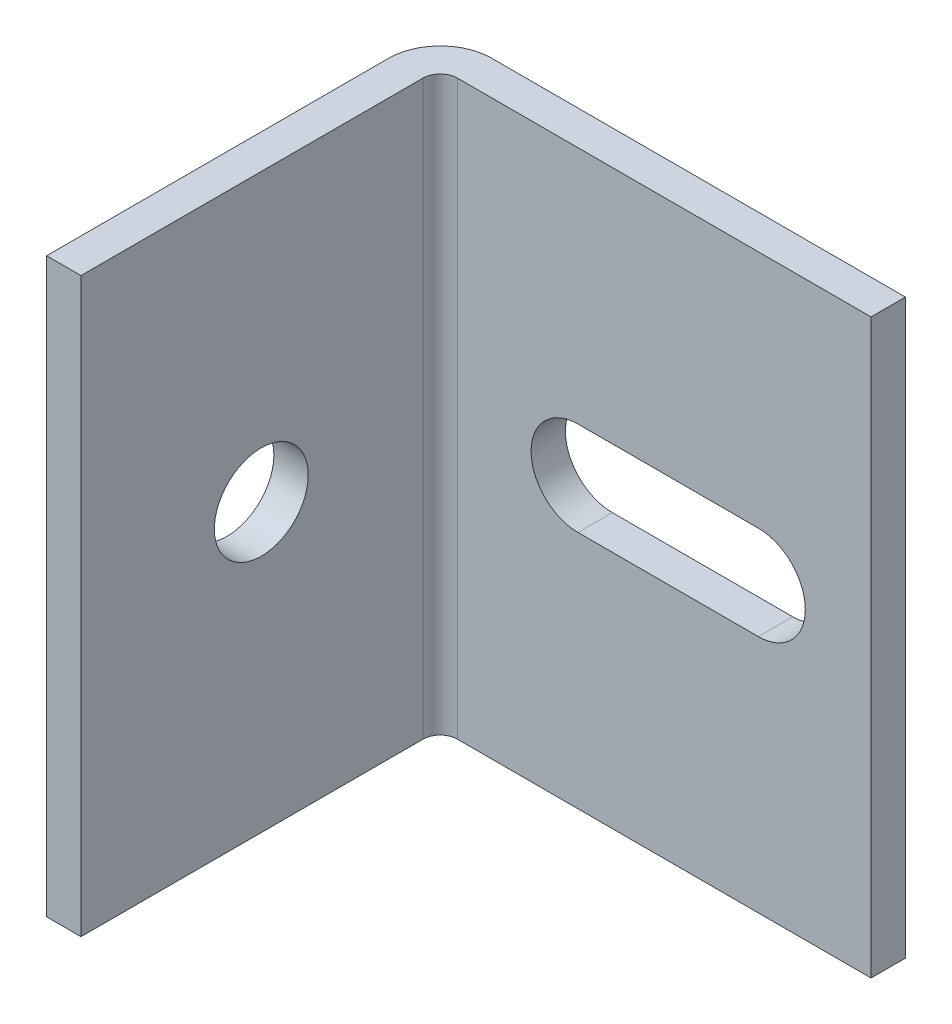
from build123d import *

# Parameters (mm, degrees)
EXTRUDE_THIN1_START = -12.7
EXTRUDE_THIN1_DEPTH = 25.4
SKETCH4_R           = 2.0828
EXTRUDE3_DEPTH      = 29.836691705
CUT_EXTRUDE1_DEPTH  = 30.868634259


# Read off the part's stored shape, not the designer's step: Extrude-Thin1
with BuildPart() as part:
    # Extrude-Thin1 outline → Extrude-Thin1 (new body)
    with BuildSketch(Plane(origin=(0, 0, 0), x_dir=(1, 0, 0), z_dir=(0, 1, 0)).offset(EXTRUDE_THIN1_START)):
        with BuildLine():
            Line((2.286, -1.524), (20.6375, -1.524))
            Line((20.6375, -1.524), (20.6375, 0))
            Line((20.6375, 0), (2.286, 0))
            ThreePointArc((2.286, 0), (0.669553898, -0.669553898), (0, -2.286))
            Line((0, -2.286), (0, -17.4625))
            Line((0, -17.4625), (1.524, -17.4625))
            Line((1.524, -17.4625), (1.524, -2.286))
            ThreePointArc((1.524, -2.286), (1.747184633, -1.747184633), (2.286, -1.524))
        make_face()
    extrude(amount=EXTRUDE_THIN1_DEPTH)

    # Sketch4 → Extrude3 (cut, through all)
    with BuildSketch(Plane(origin=(1.524, 0, 0), x_dir=(0, 0, -1), z_dir=(1, 0, 0))):
        with Locations((-9.4625, 0)):
            Circle(SKETCH4_R)
    extrude(amount=-EXTRUDE3_DEPTH, mode=Mode.SUBTRACT)

    # Sketch6 → Cut-Extrude1 (cut, through all)
    with BuildSketch(Plane.XY):
        with BuildLine():
            Line((7.6375, 2.0828), (15.6375, 2.0828))
            ThreePointArc((15.6375, 2.0828), (17.7203, 0), (15.6375, -2.0828))
            Line((15.6375, -2.0828), (7.6375, -2.0828))
            ThreePointArc((7.6375, -2.0828), (5.5547, 0), (7.6375, 2.0828))
        make_face()
    extrude(amount=CUT_EXTRUDE1_DEPTH, mode=Mode.SUBTRACT)


solid = part.part
